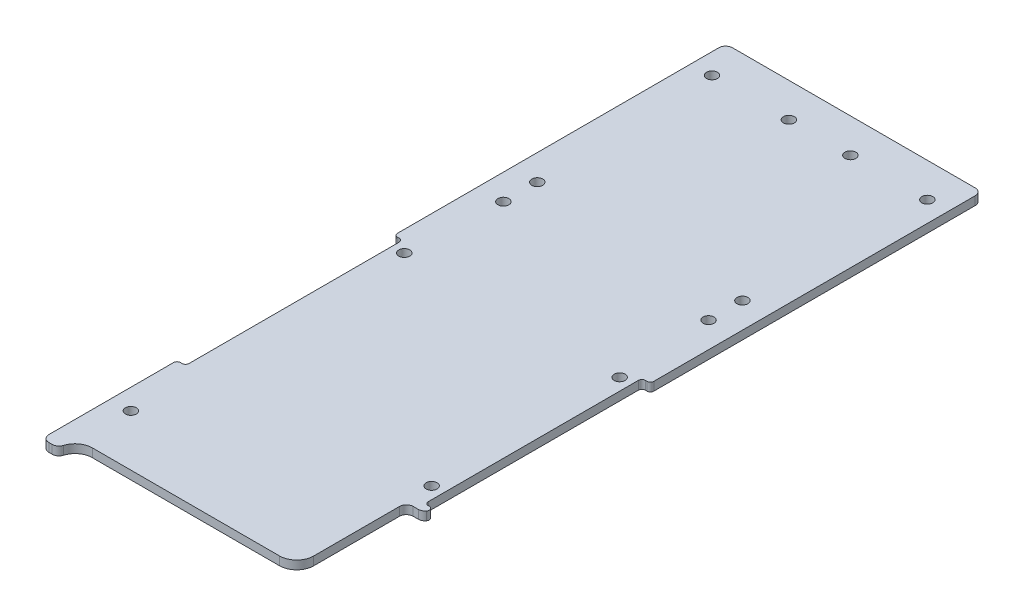
from build123d import *

# Parameters (mm, degrees)
SKETCH1_R               = 2.032
BOSS_EXTRUDE1_DEPTH     = 3.175
FILLET1_R               = 2.54
FILLET2_R               = 2.54
FILLET3_R               = 6.35
CUT_EXTRUDE1_DEPTH      = 136.673215063
FILLET4_R               = 6.35
FILLET5_R               = 2.54
SKETCH3_R               = 2.032
CUT_EXTRUDE2_DEPTH      = 136.673215063
CUT_EXTRUDE3_DEPTH      = 136.673215063
CUT_EXTRUDE3_DEPTH_BACK = 136.673215063
SKETCH4_W               = 3.175
SKETCH4_H               = 80.645
FILLET6_R               = 1.27


with BuildPart() as part:
    # Sketch1 → Boss-Extrude1 (new body)
    with BuildSketch(Plane(origin=(0, 0, 0), x_dir=(1, 0, 0), z_dir=(0, 1, 0))):
        Polygon((47.625, 127), (-47.625, 127), (-47.625, -127), (-41.275, -127), (-41.275, -120.65), (41.275, -120.65), (41.275, -127), (47.625, -127), align=None)
        with Locations((-39.999684148, -101.6)):
            Circle(SKETCH1_R, mode=Mode.SUBTRACT)
        with Locations((39.999684148, -69.85)):
            Circle(SKETCH1_R, mode=Mode.SUBTRACT)
        with Locations((-39.999684148, 0)):
            Circle(SKETCH1_R, mode=Mode.SUBTRACT)
        with Locations((-39.999684148, 114.3)):
            Circle(SKETCH1_R, mode=Mode.SUBTRACT)
        with Locations((-11.424684148, 114.3)):
            Circle(SKETCH1_R, mode=Mode.SUBTRACT)
        with Locations((39.999684148, 0)):
            Circle(SKETCH1_R, mode=Mode.SUBTRACT)
        with Locations((11.424684148, 114.3)):
            Circle(SKETCH1_R, mode=Mode.SUBTRACT)
        with Locations((39.999684148, 114.3)):
            Circle(SKETCH1_R, mode=Mode.SUBTRACT)
    extrude(amount=BOSS_EXTRUDE1_DEPTH)

    # Fillet1
    fillet1_edges = [part.edges().sort_by_distance(p)[0] for p in [
        (-47.625, 1.5875, -127),
        (47.625, 1.5875, -127),
        (47.625, 1.5875, 127),
        (-47.625, 1.5875, 127),
    ]]
    fillet(fillet1_edges, radius=FILLET1_R)

    # Fillet2
    fillet2_edges = [part.edges().sort_by_distance(p)[0] for p in [
        (41.275, 1.5875, 127),
        (-41.275, 1.5875, 127),
    ]]
    fillet(fillet2_edges, radius=FILLET2_R)

    # Fillet3
    fillet3_edges = [part.edges().sort_by_distance(p)[0] for p in [
        (41.275, 1.5875, 120.65),
        (-41.275, 1.5875, 120.65),
    ]]
    fillet(fillet3_edges, radius=FILLET3_R)

    # Sketch2 → Cut-Extrude1 (cut, through all)
    with BuildSketch(Plane.XZ):
        with BuildLine():
            Line((40.64508, 123.578690235), (40.64508, 79.88808))
            Line((40.64508, 79.88808), (47.625, 79.88808))
            Line((47.625, 79.88808), (47.625, 124.46))
            ThreePointArc((47.625, 124.46), (46.881051224, 126.256051224), (45.085, 127))
            Line((45.085, 127), (43.815, 127))
            ThreePointArc((43.815, 127), (42.297059666, 126.496530663), (41.380880287, 125.185714286))
            ThreePointArc((41.380880287, 125.185714286), (41.069166069, 124.356476684), (40.64508, 123.578690235))
        make_face()
    extrude(amount=-CUT_EXTRUDE1_DEPTH, mode=Mode.SUBTRACT)

    # Fillet4
    fillet4_edges = [part.edges().sort_by_distance(p)[0] for p in [
        (40.64508, 1.5875, 123.578690235),
    ]]
    fillet(fillet4_edges, radius=FILLET4_R)

    # Fillet5
    fillet5_edges = [part.edges().sort_by_distance(p)[0] for p in [
        (47.625, 1.5875, 79.88808),
        (40.64508, 1.5875, 79.88808),
    ]]
    fillet(fillet5_edges, radius=FILLET5_R)

    # Sketch3 → Cut-Extrude2 (cut, through all)
    with BuildSketch(Plane.XZ):
        with Locations((-38.105456535, -34.913768806)):
            Circle(SKETCH3_R)
        with Locations((-38.105456535, -47.490173279)):
            Circle(SKETCH3_R)
        with Locations((38.105456535, -47.490173279)):
            Circle(SKETCH3_R)
        with Locations((38.105456535, -34.913768806)):
            Circle(SKETCH3_R)
    extrude(amount=-CUT_EXTRUDE2_DEPTH, mode=Mode.SUBTRACT)

    # Sketch4 → Cut-Extrude3 (cut, two sides: drawn at the far end of the back side and taken through both)
    with BuildSketch(Plane(origin=(0, 3.175, 0), x_dir=(1, 0, 0), z_dir=(0, 1, 0)).offset(-CUT_EXTRUDE3_DEPTH_BACK)):
        with Locations((-46.0375, -36.5125)):
            Rectangle(SKETCH4_W, SKETCH4_H)
        with Locations((46.0375, -36.5125)):
            Rectangle(SKETCH4_W, SKETCH4_H)
    extrude(amount=CUT_EXTRUDE3_DEPTH + CUT_EXTRUDE3_DEPTH_BACK, mode=Mode.SUBTRACT)

    # Fillet6
    fillet6_edges = [part.edges().sort_by_distance(p)[0] for p in [
        (-44.45, 1.5875, -3.81),
        (-47.625, 1.5875, -3.81),
        (-47.625, 1.5875, 76.835),
        (-44.45, 1.5875, 76.835),
        (44.45, 1.5875, 76.835),
        (47.625, 1.5875, 76.835),
        (44.45, 1.5875, -3.81),
        (47.625, 1.5875, -3.81),
    ]]
    fillet(fillet6_edges, radius=FILLET6_R)


solid = part.part
